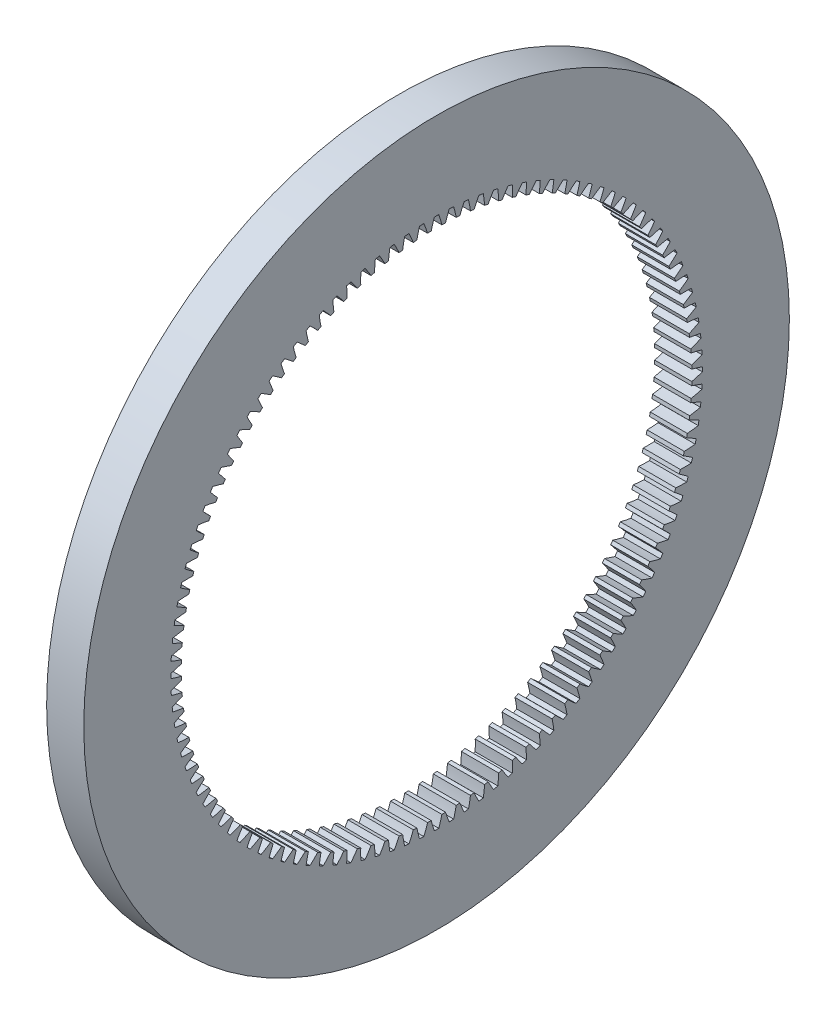
from build123d import *

# Parameters (mm, degrees)
BASPROSKE_W     = 10
BASPROSKE_H     = 26.25
TOOTHCUT_DEPTH  = 135.721935853
TEETHCUTS_COUNT = 112
TEETHCUTS_ANGLE = 356.785714286


with BuildPart() as part:
    # BasProSke → Base-Revolve (revolve)
    with BuildSketch(Plane(origin=(0, 0, 0), x_dir=(1, 0, 0), z_dir=(0, 1, 0))):
        with Locations((5, 81.875)):
            Rectangle(BASPROSKE_W, BASPROSKE_H)
    revolve(axis=Axis((-10, 0, 0), (1, 0, 0)))

    # TooCutSke → ToothCut (cut, through all)
    with BuildSketch(Plane(origin=(0, 0, 0), x_dir=(0, 0, -1), z_dir=(1, 0, 0))):
        with BuildLine():
            ThreePointArc((1.445374932, 68.709399186), (1.048830361, 70.144307226), (0.591625771, 71.56105443))
            ThreePointArc((0.591625771, 71.56105443), (0, 71.5635), (-0.591625771, 71.56105443))
            ThreePointArc((-0.591625771, 71.56105443), (-1.048830361, 70.144307226), (-1.445374932, 68.709399186))
            ThreePointArc((-1.445374932, 68.709399186), (0, 68.7246), (1.445374932, 68.709399186))
        make_face()
    toothcut = extrude(amount=TOOTHCUT_DEPTH, mode=Mode.SUBTRACT)

    # TeethCuts: ToothCut ×112 about axis
    teethcuts_axis = Axis((-10, 0, 0), (1, 0, 0))
    for i in range(1, TEETHCUTS_COUNT):
        add(toothcut.rotate(teethcuts_axis, i * TEETHCUTS_ANGLE / (TEETHCUTS_COUNT - 1)), mode=Mode.SUBTRACT)


solid = part.part
